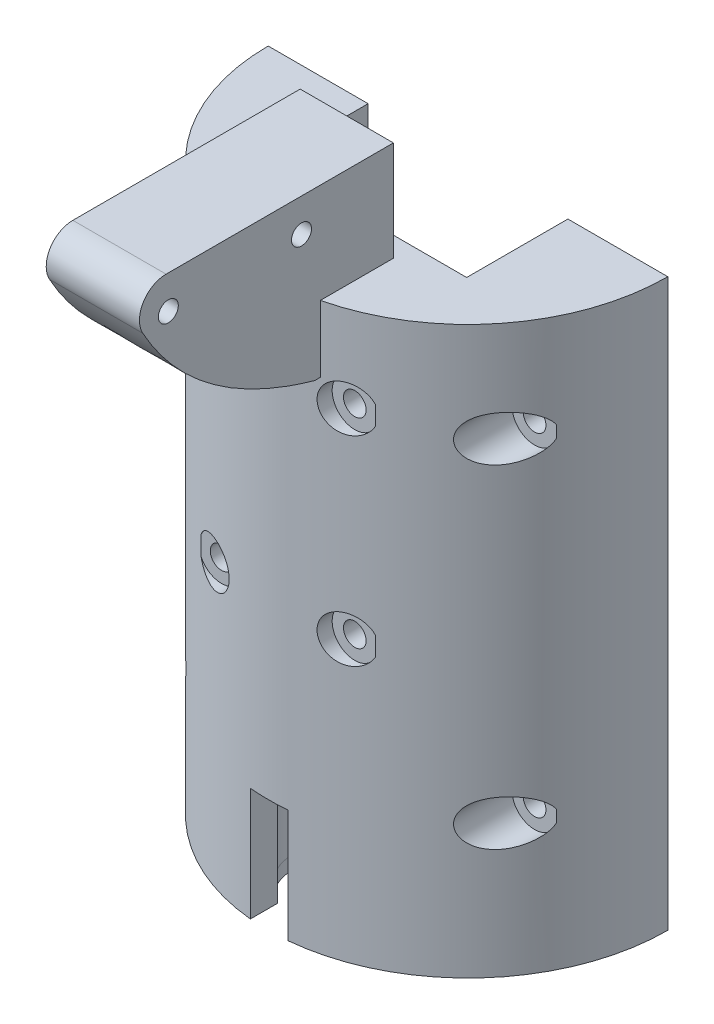
from build123d import *
from build123d.topology import SkipClean

# Parameters (mm, degrees)
EXTRUDE_1_DEPTH      = 80
SKETCH_2_R           = 1.7
CUT_EXTRUDE_1_DEPTH  = 100
SKETCH_3_R           = 1.7
CUT_EXTRUDE_2_DEPTH  = 100
SKETCH_4_R           = 3.4
CUT_EXTRUDE_3_DEPTH  = 26.5
SKETCH_5_R           = 3.4
CUT_EXTRUDE_4_DEPTH  = 13
EXTRUDE_START        = 3
EXTRUDE_2_DEPTH      = 3
EXTRUDE_3_DEPTH      = 9.5
EXTRUDE_4_DEPTH      = 7
SKETCH_14_R          = 1.5
CUT_EXTRUDE_6_DEPTH  = 14
SKETCH_18_W          = 14
SKETCH_18_H          = 3
CUT_EXTRUDE_9_DEPTH  = 20
SKETCH_19_R          = 3
CUT_EXTRUDE_10_DEPTH = 3
FILLET_4_R           = 1
CHAMFER_2_SIZE       = 2
EXTRUDE_START_2      = -10
EXTRUDE_5_DEPTH      = 10
SKETCH_25_R          = 6
CUT_EXTRUDE_14_DEPTH = 15
SKETCH_27_W          = 14
SKETCH_27_H          = 41.8
CUT_EXTRUDE_16_DEPTH = 5
FILLET_5_R           = 4
SKETCH_28_W          = 5.624944444
SKETCH_28_H          = 15.290834968
CUT_EXTRUDE_17_DEPTH = 20
EXTRUDE_START_3      = 2
EXTRUDE_6_DEPTH      = 2
EXTRUDE_7_DEPTH      = 2
EXTRUDE_8_DEPTH      = 2


# Some blends are built 0.0001 mm under size
with BuildPart() as part:
    # 草图1 → 凸台-拉伸1 (new body)
    with BuildSketch(Plane(origin=(0, 0, 0), x_dir=(1, 0, 0), z_dir=(0, 1, 0))):
        with BuildLine():
            Line((-15, 0), (-30, 0))
            ThreePointArc((-30, 0), (0, -30), (30, 0))
            Line((30, 0), (15, 0))
            Line((15, 0), (15, -15.2))
            Line((15, -15.2), (-15, -15.2))
            Line((-15, -15.2), (-15, 0))
        make_face()
    extrude(amount=EXTRUDE_1_DEPTH)

    # 草图2 → 切除-拉伸1 (cut)
    with BuildSketch(Plane.XY):
        with Locations(Location((-10, 37, 0), (0, 0, 180))):
            Circle(SKETCH_2_R)
        with Locations(Location((-10, 67, 0), (0, 0, 180))):
            Circle(SKETCH_2_R)
        with Locations(Location((10, 37, 0), (0, 0, 180))):
            Circle(SKETCH_2_R)
        with Locations(Location((10, 67, 0), (0, 0, 180))):
            Circle(SKETCH_2_R)
    extrude(amount=CUT_EXTRUDE_1_DEPTH, mode=Mode.SUBTRACT)

    # 草图3 → 切除-拉伸2 (cut)
    with BuildSketch(Plane(origin=(0, 0, 0), x_dir=(-1, 0, 0), z_dir=(0, 0, -1))):
        with Locations((23.5, 65)):
            Circle(SKETCH_3_R)
        with Locations((-23.5, 65)):
            Circle(SKETCH_3_R)
        with Locations((23.5, 15)):
            Circle(SKETCH_3_R)
        with Locations((-23.5, 15)):
            Circle(SKETCH_3_R)
    extrude(amount=-CUT_EXTRUDE_2_DEPTH, mode=Mode.SUBTRACT)

    # 草图4 → 切除-拉伸3 (cut)
    with BuildSketch(Plane(origin=(0, 0, 40), x_dir=(-1, 0, 0), z_dir=(0, 0, -1))):
        with Locations((-23.5, 65)):
            Circle(SKETCH_4_R)
        with Locations((-23.5, 15)):
            Circle(SKETCH_4_R)
        with Locations((23.5, 65)):
            Circle(SKETCH_4_R)
        with Locations((23.5, 15)):
            Circle(SKETCH_4_R)
    extrude(amount=CUT_EXTRUDE_3_DEPTH, mode=Mode.SUBTRACT)

    # 草图5 → 切除-拉伸4 (cut)
    with BuildSketch(Plane(origin=(0, 0, 40), x_dir=(-1, 0, 0), z_dir=(0, 0, -1))):
        with Locations((-10, 37)):
            Circle(SKETCH_5_R)
        with Locations((10, 37)):
            Circle(SKETCH_5_R)
        with Locations((10, 67)):
            Circle(SKETCH_5_R)
        with Locations((-10, 67)):
            Circle(SKETCH_5_R)
    extrude(amount=CUT_EXTRUDE_4_DEPTH, mode=Mode.SUBTRACT)

    # 草图6 → 凸台-拉伸2 (add)
    with SkipClean():  # the faces are left unmerged after this step: merging them gives an invalid solid
        with BuildSketch(Plane.XZ.offset(EXTRUDE_START)):
            with BuildLine():
                Line((-30, 0), (30, 0))
                ThreePointArc((30, 0), (0, 30), (-30, 0))
            make_face()
        extrude(amount=-EXTRUDE_2_DEPTH)

    # 草图7 → 凸台-拉伸3 (add)
    with SkipClean():  # the faces are left unmerged after this step: merging them gives an invalid solid
        with BuildSketch(Plane.XZ.offset(3)):
            with BuildLine():
                Line((-6, 0), (6, 0))
                ThreePointArc((6, 0), (0, 6), (-6, 0))
            make_face()
        extrude(amount=EXTRUDE_3_DEPTH)

    # 草图13 → 凸台-拉伸4 (add, symmetric)
    with SkipClean():  # the faces are left unmerged after this step: merging them gives an invalid solid
        with BuildSketch(Plane(origin=(0, 0, 0), x_dir=(0, 0, -1), z_dir=(1, 0, 0))):
            with BuildLine():
                Line((-15.2, 100), (-60, 100))
                add(Edge.make_bspline(
                    [(-60, 100), (-54.458111129, 76.859605584), (-30, 70)],
                    knots=[0, 0, 0, 1, 1, 1], degree=2))
                Line((-30, 70), (-15.2, 70))
                Line((-15.2, 70), (-15.2, 100))
            make_face()
        extrude(amount=EXTRUDE_4_DEPTH, both=True)

    # 草图14 → 切除-拉伸6 (cut)
    with SkipClean():  # the faces are left unmerged after this step: merging them gives an invalid solid
        with BuildSketch(Plane.ZY.offset(7)):
            with Locations((32, 90)):
                Circle(SKETCH_14_R)
            with Locations((52, 90)):
                Circle(SKETCH_14_R)
        extrude(amount=-CUT_EXTRUDE_6_DEPTH, mode=Mode.SUBTRACT)

    # 草图18 → 切除-拉伸9 (cut)
    with SkipClean():  # the faces are left unmerged after this step: merging them gives an invalid solid
        with BuildSketch(Plane(origin=(0, 100, 0), x_dir=(1, 0, 0), z_dir=(0, 1, 0))):
            with Locations((0, -16.7)):
                Rectangle(SKETCH_18_W, SKETCH_18_H)
        extrude(amount=-CUT_EXTRUDE_9_DEPTH, mode=Mode.SUBTRACT)

    # 草图19 → 切除-拉伸10 (cut)
    with SkipClean():  # the faces are left unmerged after this step: merging them gives an invalid solid
        with BuildSketch(Plane(origin=(0, 0, 0), x_dir=(1, 0, 0), z_dir=(0, 1, 0))):
            Circle(SKETCH_19_R)
        extrude(amount=-CUT_EXTRUDE_10_DEPTH, mode=Mode.SUBTRACT)

    # 圆角4
    # the kernel refuses this fillet: 1 mm, written as the material it adds along each edge
    with BuildSketch(Plane(origin=(0, -3, 0), x_dir=(-1, 0, 0), z_dir=(0, 0, -1))) as fillet_4_piece_1:
        with BuildLine():
            CenterArc((3 - FILLET_4_R, FILLET_4_R), FILLET_4_R, 270, 90)
            Line((3 - FILLET_4_R, 0), (3, 0))
            Line((3, 0), (3, FILLET_4_R))
        make_face()
    revolve(axis=Axis((0, -3, 0), (0, 1, 0)), revolution_arc=180)

    # 倒角2
    chamfer_2_edges = [part.edges().sort_by_distance(p)[0] for p in [
        (0, 0, 3),
    ]]
    chamfer(chamfer_2_edges, length=CHAMFER_2_SIZE - 0.0001)  # a hair under: the kernel refuses the full size

    # 草图23 → 凸台-拉伸5 (add)
    with BuildSketch(Plane.XZ.offset(12.5).offset(EXTRUDE_START_2)):
        with BuildLine():
            Line((-1.95, 7.974284096), (1.95, 7.974284096))
            Line((1.95, 7.974284096), (1.95, 5.674284096))
            ThreePointArc((1.95, 5.674284096), (0, 6), (-1.95, 5.674284096))
            Line((-1.95, 5.674284096), (-1.95, 7.974284096))
        make_face()
    extrude(amount=EXTRUDE_5_DEPTH)

    # 草图25 → 切除-拉伸14 (cut)
    with BuildSketch(Plane.XZ.offset(3)):
        with Locations(Location((0, 20.5, 0), (0, 0, 270))):
            Circle(SKETCH_25_R)
    extrude(amount=-CUT_EXTRUDE_14_DEPTH, mode=Mode.SUBTRACT)

    # 草图27 → 切除-拉伸16 (cut)
    with BuildSketch(Plane(origin=(0, 100, 0), x_dir=(1, 0, 0), z_dir=(0, 1, 0))):
        with Locations((0, -39.1)):
            Rectangle(SKETCH_27_W, SKETCH_27_H)
    extrude(amount=-CUT_EXTRUDE_16_DEPTH, mode=Mode.SUBTRACT)

    # 圆角5
    fillet_5_edges = [part.edges().sort_by_distance(p)[0] for p in [
        (3.4999997, 95, 58.513859135),
    ]]
    fillet(fillet_5_edges, radius=FILLET_5_R)

    # 草图28 → 切除-拉伸17 (cut)
    with BuildSketch(Plane(origin=(0, 0, 15.2), x_dir=(-1, 0, 0), z_dir=(0, 0, -1))):
        with Locations((0, 4.354582516)):
            Rectangle(SKETCH_28_W, SKETCH_28_H)
    extrude(amount=-CUT_EXTRUDE_17_DEPTH, mode=Mode.SUBTRACT)

    # 草图29 → 凸台-拉伸6 (add)
    with BuildSketch(Plane.XZ.offset(3).offset(EXTRUDE_START_3)):
        with BuildLine():
            ThreePointArc((-2.812472222, 25.800358429), (0, 14.499683385), (2.812472222, 25.800358429))
            Line((2.812472222, 25.800358429), (2.812472222, 29.86787572))
            ThreePointArc((2.812472222, 29.86787572), (22.185289796, 20.194378343), (30, 0))
            Line((30, 0), (6, 0))
            ThreePointArc((6, 0), (4.883646179, 3.485685012), (1.95, 5.674284096))
            Line((1.95, 5.674284096), (1.95, 7.974284096))
            Line((1.95, 7.974284096), (-1.95, 7.974284096))
            Line((-1.95, 7.974284096), (-1.95, 5.674284096))
            ThreePointArc((-1.95, 5.674284096), (-4.883646179, 3.485685012), (-6, 0))
            Line((-6, 0), (-30, 0))
            ThreePointArc((-30, 0), (-22.185289796, 20.194378343), (-2.812472222, 29.86787572))
            Line((-2.812472222, 29.86787572), (-2.812472222, 25.800358429))
        make_face()
    extrude(amount=-EXTRUDE_6_DEPTH)

    # 草图30 → 凸台-拉伸7 (add)
    with BuildSketch(Plane.XZ.offset(12.5)):
        with BuildLine():
            Line((-6, 0), (6, 0))
            ThreePointArc((6, 0), (0, 6), (-6, 0))
        make_face()
    extrude(amount=EXTRUDE_7_DEPTH)

    # 草图31 → 凸台-拉伸8 (add)
    with BuildSketch(Plane.XZ.offset(12.5)):
        with BuildLine():
            Line((1.95, 5.674284096), (1.95, 7.974284096))
            Line((1.95, 7.974284096), (-1.95, 7.974284096))
            Line((-1.95, 7.974284096), (-1.95, 5.674284096))
            ThreePointArc((-1.95, 5.674284096), (0, 6), (1.95, 5.674284096))
        make_face()
    extrude(amount=EXTRUDE_8_DEPTH)


solid = part.part
